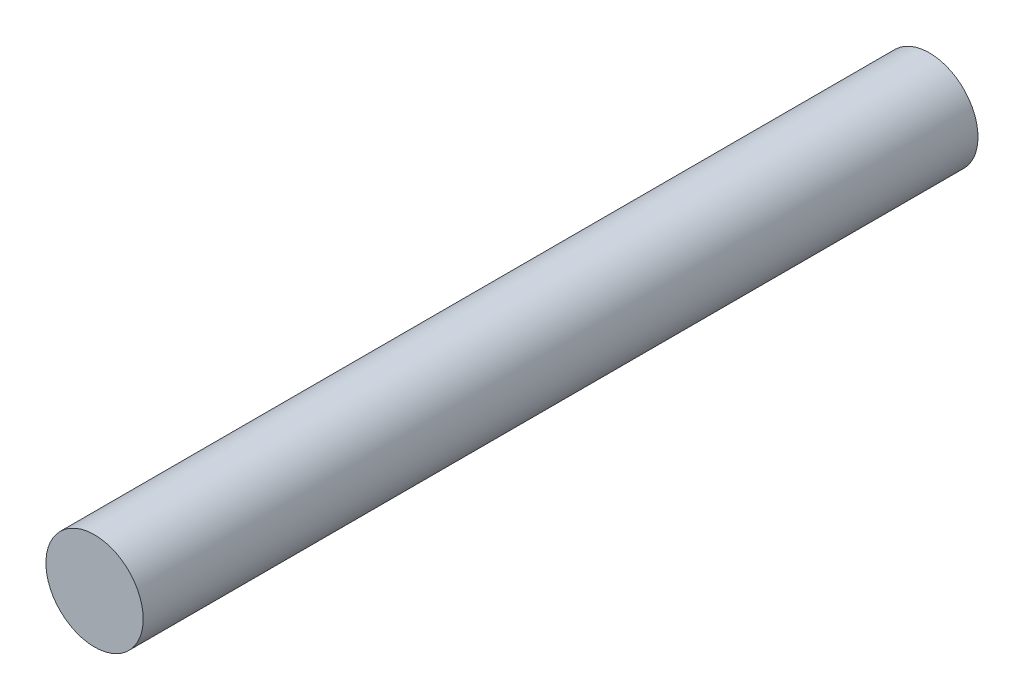
from build123d import *

# Parameters (mm, degrees)
SKETCH1_R           = 1.999996
BOSS_EXTRUDE1_DEPTH = 34.33064


with BuildPart() as part:
    # Sketch1 → Boss-Extrude1 (new body)
    with BuildSketch(Plane.XY):
        Circle(SKETCH1_R)
    extrude(amount=BOSS_EXTRUDE1_DEPTH)


solid = part.part
